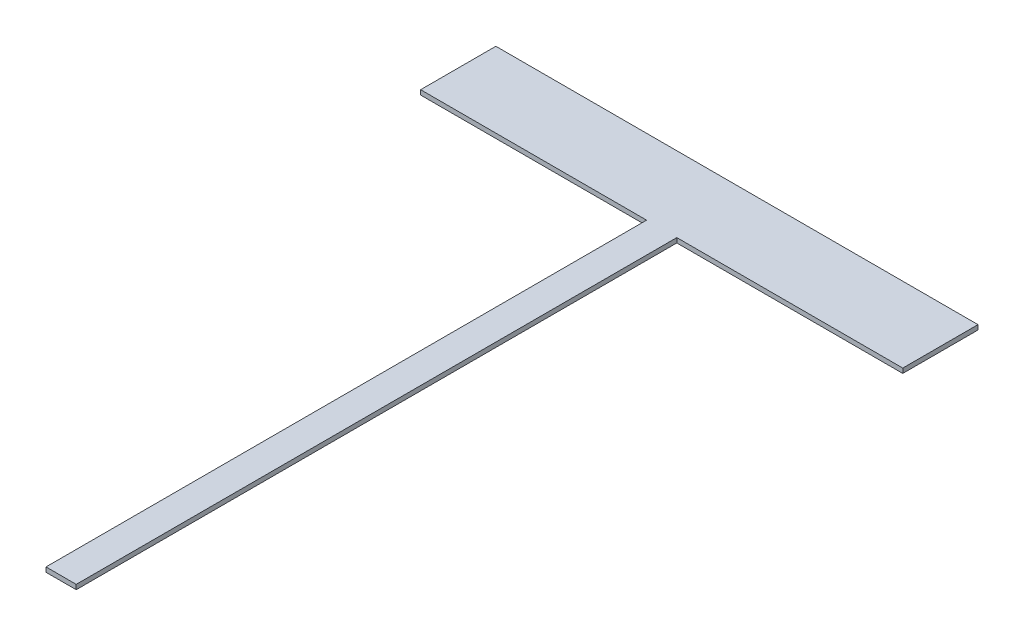
from build123d import *

# Parameters (mm, degrees)
BOSS_EXTRUDE1_DEPTH = 1.57


with BuildPart() as part:
    # Sketch1 → Boss-Extrude1 (new body)
    with BuildSketch(Plane(origin=(0, 0, 0), x_dir=(1, 0, 0), z_dir=(0, 1, 0))):
        Polygon((-5.08, 0), (-5.08, -202), (5.08, -202), (5.08, 0), (81.08, 0), (81.08, 25.3), (-81.08, 25.3), (-81.08, 0), align=None)
    extrude(amount=BOSS_EXTRUDE1_DEPTH)


solid = part.part
